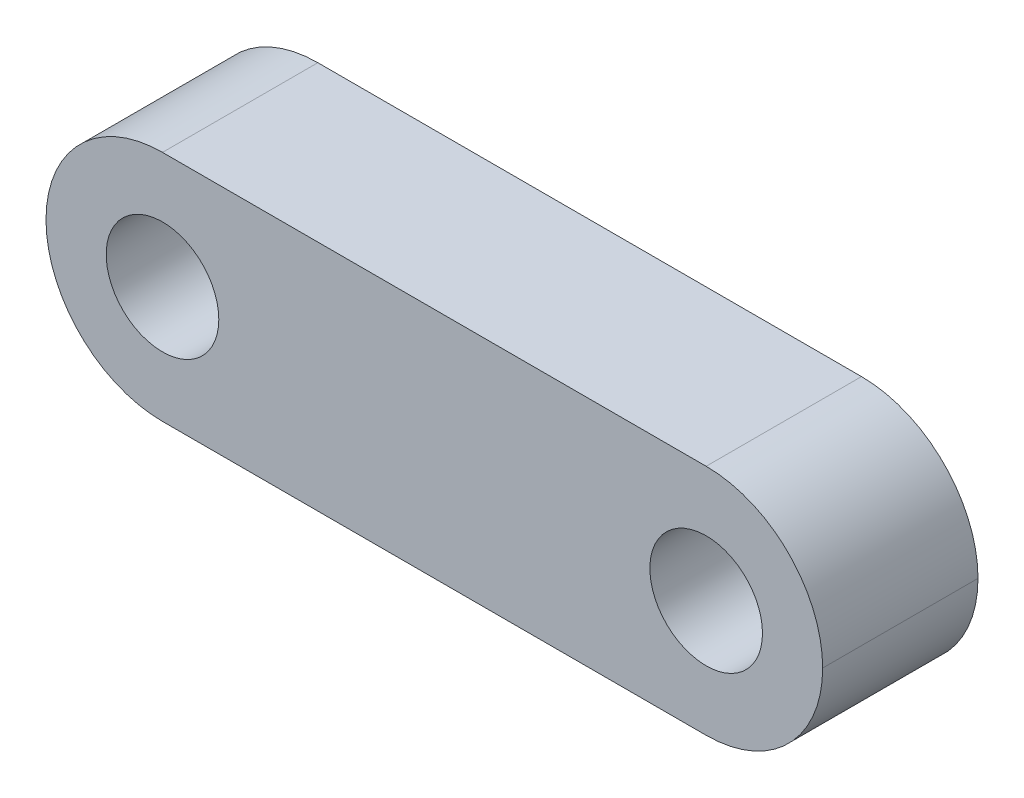
from build123d import *

# Parameters (mm, degrees)
SKETCH1_W               = 20
SKETCH1_H               = 6
BOSS_EXTRUDE1_DEPTH     = 4
CUT_EXTRUDE1_DEPTH      = 22.260291625
CUT_EXTRUDE1_DEPTH_BACK = 22.260291625
SKETCH2_R               = 1.45
FILLET1_R               = 3


with BuildPart() as part:
    # Sketch1 → Boss-Extrude1 (new body)
    with BuildSketch(Plane.XY):
        with Locations((10, -3)):
            Rectangle(SKETCH1_W, SKETCH1_H)
    extrude(amount=BOSS_EXTRUDE1_DEPTH)

    # Sketch2 → Cut-Extrude1 (cut, two sides: drawn at the far end of the back side and taken through both)
    with BuildSketch(Plane.XY.offset(4).offset(-CUT_EXTRUDE1_DEPTH_BACK)):
        with Locations((3, -3)):
            Circle(SKETCH2_R)
        with Locations((17, -3)):
            Circle(SKETCH2_R)
    extrude(amount=CUT_EXTRUDE1_DEPTH + CUT_EXTRUDE1_DEPTH_BACK, mode=Mode.SUBTRACT)

    # Fillet1
    fillet1_edges = [part.edges().sort_by_distance(p)[0] for p in [
        (20, -6, 2),
        (20, 0, 2),
        (0, -6, 2),
        (0, 0, 2),
    ]]
    fillet(fillet1_edges, radius=FILLET1_R - 0.0001)  # a hair under: the kernel refuses the full size


solid = part.part
